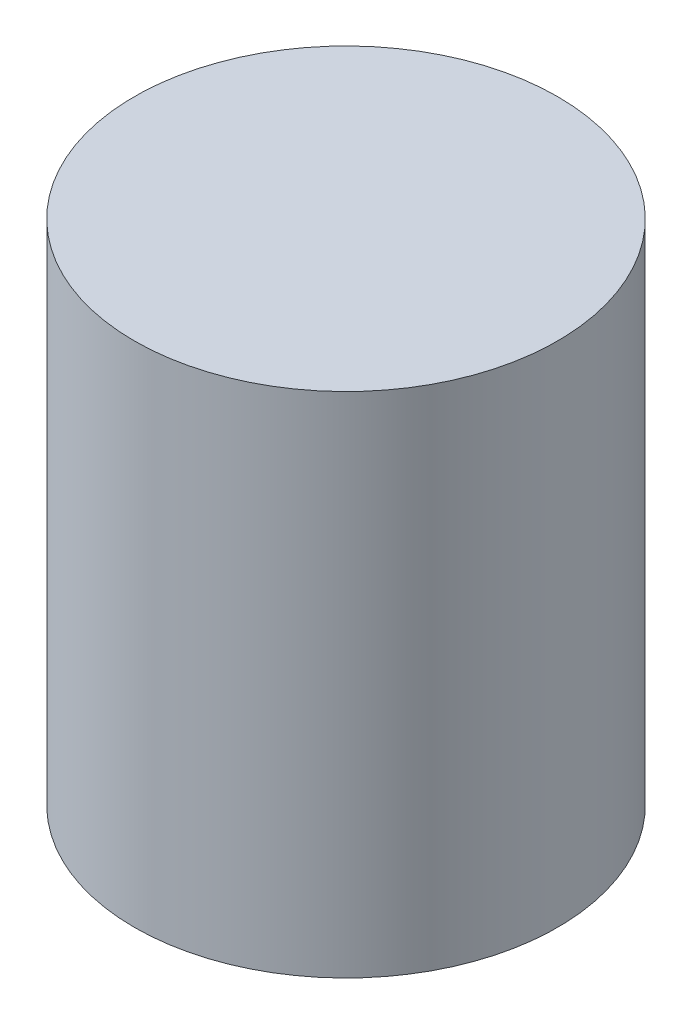
from build123d import *

# Parameters (mm, degrees)
SKETCH2_R           = 63.5
BOSS_EXTRUDE1_DEPTH = 152.4


with BuildPart() as part:
    # Sketch2 → Boss-Extrude1 (new body)
    with BuildSketch(Plane(origin=(0, 0, 0), x_dir=(1, 0, 0), z_dir=(0, 1, 0))):
        Circle(SKETCH2_R)
    extrude(amount=BOSS_EXTRUDE1_DEPTH)


solid = part.part
